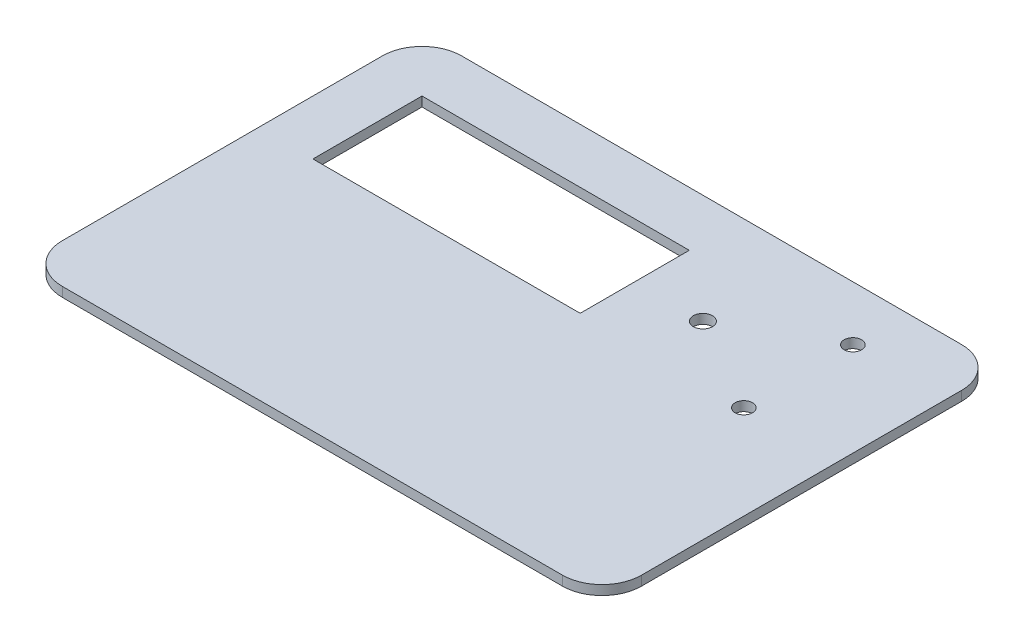
from build123d import *

# Parameters (mm, degrees)
BOSS_EXTRUDE1_DEPTH = 3.5
SKETCH2_R           = 3.5
SKETCH2_R_2         = 3.2
SKETCH2_W           = 98
SKETCH2_H           = 40
CUT_EXTRUDE1_DEPTH  = 3.5


with BuildPart() as part:
    # Sketch1 → Boss-Extrude1 (new body)
    with BuildSketch(Plane(origin=(0, 0, 0), x_dir=(1, 0, 0), z_dir=(0, 1, 0))):
        with BuildLine():
            Line((-91.7, 73.2), (91.7, 73.2))
            ThreePointArc((91.7, 73.2), (101.953048327, 68.953048327), (106.2, 58.7))
            Line((106.2, 58.7), (106.2, -58.7))
            ThreePointArc((106.2, -58.7), (101.953048327, -68.953048327), (91.7, -73.2))
            Line((91.7, -73.2), (-91.7, -73.2))
            ThreePointArc((-91.7, -73.2), (-101.953048327, -68.953048327), (-106.2, -58.7))
            Line((-106.2, -58.7), (-106.2, 58.7))
            ThreePointArc((-106.2, 58.7), (-101.953048327, 68.953048327), (-91.7, 73.2))
        make_face()
    extrude(amount=BOSS_EXTRUDE1_DEPTH)

    # Sketch2 → Cut-Extrude1 (cut)
    with BuildSketch(Plane(origin=(0, 3.5, 0), x_dir=(1, 0, 0), z_dir=(0, 1, 0))):
        with Locations((36.8, 33.2)):
            Circle(SKETCH2_R)
        with Locations((71.8, 53.2)):
            Circle(SKETCH2_R_2)
        with Locations((71.8, 13.2)):
            Circle(SKETCH2_R_2)
        with Locations((-37.2, 33.2)):
            Rectangle(SKETCH2_W, SKETCH2_H)
    extrude(amount=-CUT_EXTRUDE1_DEPTH, mode=Mode.SUBTRACT)


solid = part.part
